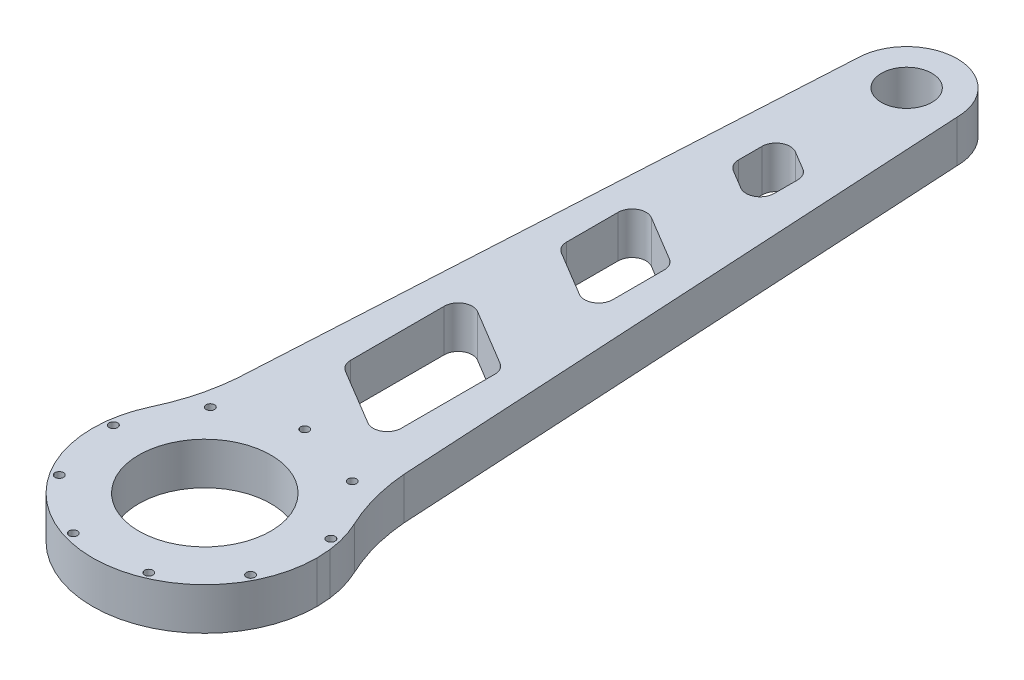
from build123d import *

# Parameters (mm, degrees)
SKETCH_1_R          = 5.05
SKETCH_1_R_2        = 13
EXTRUDE_1_DEPTH     = 15
FILLET_1_R          = 3
SKETCH_7_R          = 2.05
CUT_EXTRUDE_4_DEPTH = 277.54113618
SKETCH_8_R          = 13
CUT_EXTRUDE_5_DEPTH = 277.54113618
SKETCH_9_R          = 25
SKETCH_9_R_2        = 13
EXTRUDE_4_DEPTH     = 15
SKETCH_10_R         = 1.5
EXTRUDE_5_DEPTH     = 15
EXTRUDE_START       = -15
SKETCH_14_R         = 13
SKETCH_14_R_2       = 9
EXTRUDE_6_DEPTH     = 15
SKETCH_13_R         = 23.5
SKETCH_13_R_2       = 1.5
CUT_EXTRUDE_6_DEPTH = 25
CUT_EXTRUDE_START   = -15
CUT_EXTRUDE_7_DEPTH = 15
EXTRUDE_9_DEPTH     = 15
CUT_EXTRUDE_8_DEPTH = 30


# Read off the part's stored shape, not the designer's step: 切除-拉伸7
with BuildPart() as part:
    # 草图1 → 凸台-拉伸1 (new body)
    with BuildSketch(Plane(origin=(0, 0, 0), x_dir=(1, 0, 0), z_dir=(0, 1, 0))):
        with BuildLine():
            Line((-17.992942616, -0.504), (-24.990198078, 249.3))
            ThreePointArc((-24.990198078, 249.3), (0, 275), (24.990198078, 249.3))
            Line((24.990198078, 249.3), (17.992942616, -0.504))
            ThreePointArc((17.992942616, -0.504), (0, -18), (-17.992942616, -0.504))
        make_face()
        with Locations(Location((0, 0, 0), (0, 0, 270))):
            Circle(SKETCH_1_R, mode=Mode.SUBTRACT)
        with Locations(Location((0, 250, 0), (0, 0, 270))):
            Circle(SKETCH_1_R_2, mode=Mode.SUBTRACT)
        Polygon((-16.444447487, 158.5), (-17.704941698, 203.5), (11.028871219, 137.174942267), align=None, mode=Mode.SUBTRACT)
        Polygon((15.954255294, 141), (18.475243716, 231), (-12, 219.5), align=None, mode=Mode.SUBTRACT)
    extrude(amount=EXTRUDE_1_DEPTH)

    # 圆角1
    fillet_1_edges = [part.edges().sort_by_distance(p)[0] for p in [
        (-16.444447487, 7.5, -158.5),
        (11.028871219, 7.5, -137.174942267),
        (-17.704941698, 7.5, -203.5),
        (18.475243716, 7.5, -231),
        (-12, 7.5, -219.5),
        (15.954255294, 7.5, -141),
    ]]
    fillet(fillet_1_edges, radius=FILLET_1_R)

    # 草图7 → 切除-拉伸4 (cut, through all)
    with BuildSketch(Plane(origin=(0, 15, 0), x_dir=(1, 0, 0), z_dir=(0, 1, 0))):
        with Locations(Location((15, 15, 0), (0, 0, 270))):
            Circle(SKETCH_7_R)
        with Locations(Location((-15, 15, 0), (0, 0, 270))):
            Circle(SKETCH_7_R)
        with Locations((-15, -15)):
            Circle(SKETCH_7_R)
        with Locations((15, -15)):
            Circle(SKETCH_7_R)
    extrude(amount=-CUT_EXTRUDE_4_DEPTH, mode=Mode.SUBTRACT)

    # 草图8 → 切除-拉伸5 (cut, through all)
    with BuildSketch(Plane(origin=(0, 15, 0), x_dir=(1, 0, 0), z_dir=(0, 1, 0))):
        with Locations(Location((0, 0, 0), (0, 0, 270))):
            Circle(SKETCH_8_R)
    extrude(amount=-CUT_EXTRUDE_5_DEPTH, mode=Mode.SUBTRACT)

    # 草图9 → 凸台-拉伸4 (add)
    with BuildSketch(Plane(origin=(0, 15, 0), x_dir=(1, 0, 0), z_dir=(0, 1, 0))):
        Circle(SKETCH_9_R)
        with Locations(Location((0, 0, 0), (0, 0, 270))):
            Circle(SKETCH_9_R_2, mode=Mode.SUBTRACT)
    extrude(amount=-EXTRUDE_4_DEPTH)

    # 草图10 → 凸台-拉伸5 (add)
    with BuildSketch(Plane(origin=(0, 15, 0), x_dir=(1, 0, 0), z_dir=(0, 1, 0))):
        with BuildLine():
            Line((-39.711049207, 4.799226071), (-40, 0))
            ThreePointArc((-40, 0), (0, -40), (40, 0))
            Line((40, 0), (39.711049207, 4.799226071))
            Line((39.711049207, 4.799226071), (24.990198078, 249.3))
            Line((24.990198078, 249.3), (18.993134598, 35.203136766))
            Line((18.993134598, 35.203136766), (18.478724461, 16.838549294))
            ThreePointArc((18.478724461, 16.838549294), (0, -25), (-18.478724461, 16.838549294))
            Line((-18.478724461, 16.838549294), (-18.993134598, 35.203136766))
            Line((-18.993134598, 35.203136766), (-24.990198078, 249.3))
            Line((-24.990198078, 249.3), (-39.711049207, 4.799226071))
        make_face()
        with Locations(Location((-31.493406412, -20.357194124, 0), (0, 0, 270))):
            Circle(SKETCH_10_R, mode=Mode.SUBTRACT)
        with Locations(Location((-37.210701127, 4.649055992, 0), (0, 0, 270))):
            Circle(SKETCH_10_R, mode=Mode.SUBTRACT)
        with Locations(Location((-25.516695234, 27.479961141, 0), (0, 0, 270))):
            Circle(SKETCH_10_R, mode=Mode.SUBTRACT)
        with Locations(Location((-11.039996826, -35.838086864, 0), (0, 0, 270))):
            Circle(SKETCH_10_R, mode=Mode.SUBTRACT)
        with Locations(Location((14.579149971, -34.549940465, 0), (0, 0, 270))):
            Circle(SKETCH_10_R, mode=Mode.SUBTRACT)
        with Locations(Location((33.376550467, -17.095492942, 0), (0, 0, 270))):
            Circle(SKETCH_10_R, mode=Mode.SUBTRACT)
        with Locations(Location((22.631551157, 29.900884473, 0), (0, 0, 270))):
            Circle(SKETCH_10_R, mode=Mode.SUBTRACT)
        with Locations(Location((36.55669206, 8.358125723, 0), (0, 0, 270))):
            Circle(SKETCH_10_R, mode=Mode.SUBTRACT)
    extrude(amount=-EXTRUDE_5_DEPTH)

    # 草图14 → 凸台-拉伸6 (add)
    with BuildSketch(Plane(origin=(0, 15, 0), x_dir=(1, 0, 0), z_dir=(0, 1, 0)).offset(EXTRUDE_START)):
        with Locations((0, 250)):
            Circle(SKETCH_14_R)
        with Locations(Location((0, 250, 0), (0, 0, 270))):
            Circle(SKETCH_14_R_2, mode=Mode.SUBTRACT)
    extrude(amount=EXTRUDE_6_DEPTH)

    # 草图13 → 切除-拉伸6 (cut)
    with BuildSketch(Plane(origin=(0, 15, 0), x_dir=(1, 0, 0), z_dir=(0, 1, 0))):
        with Locations(Location((0, 0, 0), (0, 0, 270))):
            Circle(SKETCH_13_R)
        with Locations(Location((-1.883144055, 37.452687066, 0), (0, 0, 270))):
            Circle(SKETCH_13_R_2)
    extrude(amount=-CUT_EXTRUDE_6_DEPTH, mode=Mode.SUBTRACT)

    # 切除-拉伸7 outline → 切除-拉伸7 (cut)
    with BuildSketch(Plane(origin=(0, 15, 0), x_dir=(1, 0, 0), z_dir=(0, 1, 0)).offset(CUT_EXTRUDE_START)):
        with BuildLine():
            ThreePointArc((-39.711049207, 4.799226071), (-38.432072473, 11.089445679), (-36.163406358, 17.094093734))
            ThreePointArc((-36.163406358, 17.094093734), (-31.834646693, 28.891099747), (-29.684840552, 41.271965817))
            Line((-29.684840552, 41.271965817), (-18, 250))
            ThreePointArc((-18, 250), (0, 268), (18, 250))
            Line((18, 250), (29.684856444, 41.271998774))
            ThreePointArc((29.684856444, 41.271998774), (31.834654407, 28.891107358), (36.163414547, 17.09407641))
            ThreePointArc((36.163414547, 17.09407641), (38.432075129, 11.089436474), (39.711049207, 4.799226071))
            Line((39.711049207, 4.799226071), (24.990198078, 249.3))
            ThreePointArc((24.990198078, 249.3), (0, 275), (-24.990198078, 249.3))
            Line((-24.990198078, 249.3), (-39.711049207, 4.799226071))
        make_face()
    extrude(amount=CUT_EXTRUDE_7_DEPTH, mode=Mode.SUBTRACT)

    # 草图18 → 凸台-拉伸9 (add)
    with BuildSketch(Plane(origin=(0, 0, 0), x_dir=(-1, 0, 0), z_dir=(0, -1, 0))):
        Polygon((-20.868155543, 131.844626328), (20.706902291, 152.097209515), (16.905995412, 230.591726078), (-18.51031166, 232.603381148), (-19.336560971, 196.02914685), align=None)
    extrude(amount=-EXTRUDE_9_DEPTH)

    # 草图19 → 切除-拉伸8 (cut)
    with BuildSketch(Plane(origin=(0, 15, 0), x_dir=(1, 0, 0), z_dir=(0, 1, 0))):
        with BuildLine():
            Line((-7.714285714, 206.181987904), (-7.714285714, 197.835106113))
            ThreePointArc((-7.714285714, 197.835106113), (-7.063735021, 195.368876049), (-5.281369423, 193.544409057))
            Line((-5.281369423, 193.544409057), (1.432916291, 189.52731504))
            ThreePointArc((1.432916291, 189.52731504), (6.466230064, 189.468562789), (9, 193.818012096))
            Line((9, 193.818012096), (9, 202.164893887))
            ThreePointArc((9, 202.164893887), (8.349449307, 204.631123951), (6.567083709, 206.455590943))
            Line((6.567083709, 206.455590943), (-0.147202005, 210.47268496))
            ThreePointArc((-0.147202005, 210.47268496), (-5.180515778, 210.531437211), (-7.714285714, 206.181987904))
        make_face()
        with BuildLine():
            Line((-13, 160.211585543), (-13, 141.864703752))
            ThreePointArc((-13, 141.864703752), (-12.349449307, 139.398473689), (-10.567083709, 137.574006696))
            Line((-10.567083709, 137.574006696), (5.432916291, 128.001357123))
            ThreePointArc((5.432916291, 128.001357123), (10.466230064, 127.942604873), (13, 132.29205418))
            Line((13, 132.29205418), (13, 150.63893597))
            ThreePointArc((13, 150.63893597), (12.349449307, 153.105166034), (10.567083709, 154.929633027))
            Line((10.567083709, 154.929633027), (-5.432916291, 164.5022826))
            ThreePointArc((-5.432916291, 164.5022826), (-10.466230064, 164.56103485), (-13, 160.211585543))
        make_face()
        with BuildLine():
            Line((-15, 100.278326449), (-15, 66.931444658))
            ThreePointArc((-15, 66.931444658), (-14.349449307, 64.465214594), (-12.567083709, 62.640747602))
            Line((-12.567083709, 62.640747602), (7.432916291, 50.674935636))
            ThreePointArc((7.432916291, 50.674935636), (12.466230064, 50.616183385), (15, 54.965632692))
            Line((15, 54.965632692), (15, 88.312514483))
            ThreePointArc((15, 88.312514483), (14.349449307, 90.778744547), (12.567083709, 92.60321154))
            Line((12.567083709, 92.60321154), (-7.432916291, 104.569023505))
            ThreePointArc((-7.432916291, 104.569023505), (-12.466230064, 104.627775756), (-15, 100.278326449))
        make_face()
    extrude(amount=-CUT_EXTRUDE_8_DEPTH, mode=Mode.SUBTRACT)


solid = part.part
